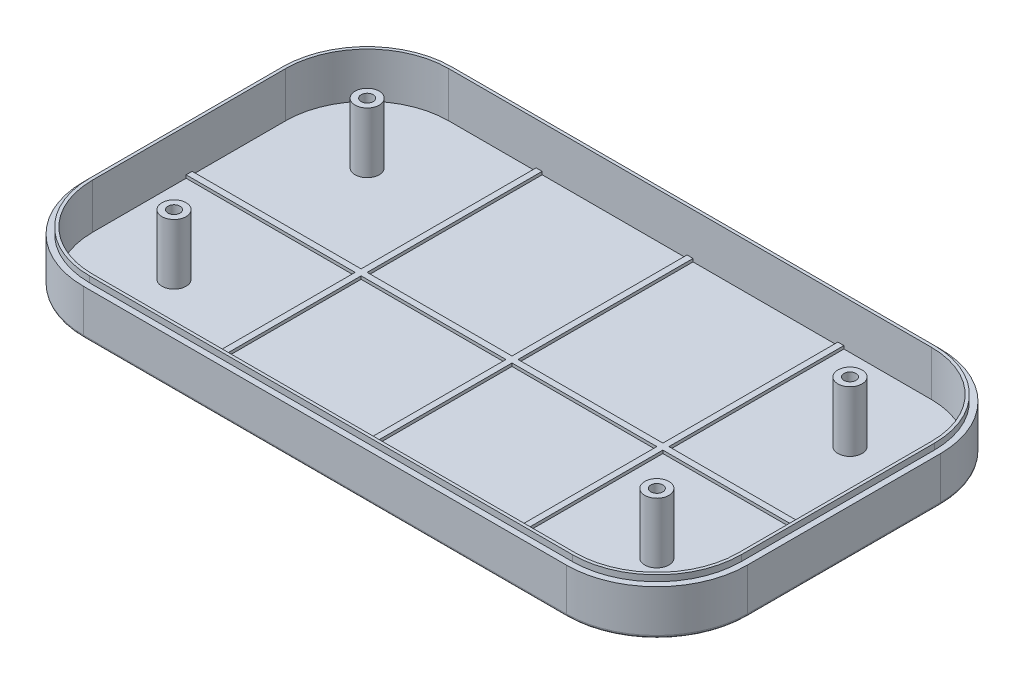
from build123d import *

# Parameters (mm, degrees)
BOSS_EXTRUDE1_DEPTH = 15
CUT_EXTRUDE1_DEPTH  = 13
BOSS_EXTRUDE2_START = 15
BOSS_EXTRUDE2_DEPTH = 15
BOSS_EXTRUDE3_DEPTH = 2
SKETCH6_R           = 4
BOSS_EXTRUDE4_DEPTH = 20
SKETCH7_R           = 2
CUT_EXTRUDE2_DEPTH  = 54
SKETCH8_R           = 3.5
CUT_EXTRUDE3_DEPTH  = 10
BOSS_EXTRUDE5_DEPTH = 1
FILLET1_R           = 1


with BuildPart() as part:
    # Sketch1 → Boss-Extrude1 (new body)
    with BuildSketch(Plane(origin=(0, 0, 0), x_dir=(1, 0, 0), z_dir=(0, 1, 0))):
        with BuildLine():
            Line((-80, 62), (80, 62))
            ThreePointArc((80, 62), (101.213203436, 53.213203436), (110, 32))
            Line((110, 32), (110, -32))
            ThreePointArc((110, -32), (101.213203436, -53.213203436), (80, -62))
            Line((80, -62), (-80, -62))
            ThreePointArc((-80, -62), (-101.213203436, -53.213203436), (-110, -32))
            Line((-110, -32), (-110, 32))
            ThreePointArc((-110, 32), (-101.213203436, 53.213203436), (-80, 62))
        make_face()
    extrude(amount=BOSS_EXTRUDE1_DEPTH)

    # Sketch2 → Cut-Extrude1 (cut)
    with BuildSketch(Plane(origin=(0, 15, 0), x_dir=(1, 0, 0), z_dir=(0, 1, 0))):
        with BuildLine():
            Line((-80, -60), (80, -60))
            ThreePointArc((80, -60), (99.798989873, -51.798989873), (108, -32))
            Line((108, -32), (108, 32))
            ThreePointArc((108, 32), (99.798989873, 51.798989873), (80, 60))
            Line((80, 60), (-80, 60))
            ThreePointArc((-80, 60), (-99.798989873, 51.798989873), (-108, 32))
            Line((-108, 32), (-108, -32))
            ThreePointArc((-108, -32), (-99.798989873, -51.798989873), (-80, -60))
        make_face()
    extrude(amount=-CUT_EXTRUDE1_DEPTH, mode=Mode.SUBTRACT)

    # Sketch3 → Boss-Extrude2 (add)
    with BuildSketch(Plane(origin=(0, 2, 0), x_dir=(1, 0, 0), z_dir=(0, 1, 0)).offset(BOSS_EXTRUDE2_START)):
        with BuildLine():
            Line((-80, -60), (80, -60))
            ThreePointArc((80, -60), (99.798989873, -51.798989873), (108, -32))
            Line((108, -32), (108, 32))
            ThreePointArc((108, 32), (99.798989873, 51.798989873), (80, 60))
            Line((80, 60), (-80, 60))
            ThreePointArc((-80, 60), (-99.798989873, 51.798989873), (-108, 32))
            Line((-108, 32), (-108, -32))
            ThreePointArc((-108, -32), (-99.798989873, -51.798989873), (-80, -60))
        make_face()
        with BuildLine():
            Line((-80, -59), (80, -59))
            ThreePointArc((80, -59), (99.091883092, -51.091883092), (107, -32))
            Line((107, -32), (107, 32))
            ThreePointArc((107, 32), (99.091883092, 51.091883092), (80, 59))
            Line((80, 59), (-80, 59))
            ThreePointArc((-80, 59), (-99.091883092, 51.091883092), (-107, 32))
            Line((-107, 32), (-107, -32))
            ThreePointArc((-107, -32), (-99.091883092, -51.091883092), (-80, -59))
        make_face(mode=Mode.SUBTRACT)
    extrude(amount=-BOSS_EXTRUDE2_DEPTH)

    # Sketch5 → Boss-Extrude3 (add)
    with BuildSketch(Plane.XZ):
        with BuildLine():
            Line((-88, 32), (-88, 20))
            Line((-88, 20), (-90, 20))
            Line((-90, 20), (-90, 32))
            ThreePointArc((-90, 32), (-87.071067812, 39.071067812), (-80, 42))
            Line((-80, 42), (-68, 42))
            Line((-68, 42), (-68, 40))
            Line((-68, 40), (-80, 40))
            ThreePointArc((-80, 40), (-85.656854249, 37.656854249), (-88, 32))
        make_face()
        with BuildLine():
            Line((-80, -40), (-68, -40))
            Line((-68, -40), (-68, -42))
            Line((-68, -42), (-80, -42))
            ThreePointArc((-80, -42), (-87.071067812, -39.071067812), (-90, -32))
            Line((-90, -32), (-90, -20))
            Line((-90, -20), (-88, -20))
            Line((-88, -20), (-88, -32))
            ThreePointArc((-88, -32), (-85.656854249, -37.656854249), (-80, -40))
        make_face()
        with BuildLine():
            Line((88, -32), (88, -20))
            Line((88, -20), (90, -20))
            Line((90, -20), (90, -32))
            ThreePointArc((90, -32), (87.071067812, -39.071067812), (80, -42))
            Line((80, -42), (68, -42))
            Line((68, -42), (68, -40))
            Line((68, -40), (80, -40))
            ThreePointArc((80, -40), (85.656854249, -37.656854249), (88, -32))
        make_face()
        with BuildLine():
            Line((80, 40), (68, 40))
            Line((68, 40), (68, 42))
            Line((68, 42), (80, 42))
            ThreePointArc((80, 42), (87.071067812, 39.071067812), (90, 32))
            Line((90, 32), (90, 20))
            Line((90, 20), (88, 20))
            Line((88, 20), (88, 32))
            ThreePointArc((88, 32), (85.656854249, 37.656854249), (80, 40))
        make_face()
    extrude(amount=BOSS_EXTRUDE3_DEPTH)

    # Sketch6 → Boss-Extrude4 (add)
    with BuildSketch(Plane(origin=(0, 2, 0), x_dir=(1, 0, 0), z_dir=(0, 1, 0))):
        with Locations((80, 32)):
            Circle(SKETCH6_R)
        with Locations((80, -32)):
            Circle(SKETCH6_R)
        with Locations((-80, -32)):
            Circle(SKETCH6_R)
        with Locations((-80, 32)):
            Circle(SKETCH6_R)
    extrude(amount=BOSS_EXTRUDE4_DEPTH)

    # Sketch7 → Cut-Extrude2 (cut)
    with BuildSketch(Plane(origin=(0, 22, 0), x_dir=(1, 0, 0), z_dir=(0, 1, 0))):
        with Locations((80, 32)):
            Circle(SKETCH7_R)
        with Locations((80, -32)):
            Circle(SKETCH7_R)
        with Locations((-80, -32)):
            Circle(SKETCH7_R)
        with Locations((-80, 32)):
            Circle(SKETCH7_R)
    extrude(amount=-CUT_EXTRUDE2_DEPTH, mode=Mode.SUBTRACT)

    # Sketch8 → Cut-Extrude3 (cut)
    with BuildSketch(Plane.XZ):
        with Locations((-80, 32)):
            Circle(SKETCH8_R)
        with Locations((-80, -32)):
            Circle(SKETCH8_R)
        with Locations((80, -32)):
            Circle(SKETCH8_R)
        with Locations((80, 32)):
            Circle(SKETCH8_R)
    extrude(amount=-CUT_EXTRUDE3_DEPTH, mode=Mode.SUBTRACT)

    # Sketch9 → Boss-Extrude5 (add)
    with BuildSketch(Plane(origin=(0, 2, 0), x_dir=(1, 0, 0), z_dir=(0, 1, 0))):
        Polygon((49, -59), (51, -59), (51, -1), (107, -1), (107, 1), (51, 1), (51, 59), (49, 59), (49, 1), (1, 1), (1, 59), (-1, 59), (-1, 1), (-49, 1), (-49, 59), (-51, 59), (-51, 1), (-107, 1), (-107, -1), (-51, -1), (-51, -59), (-49, -59), (-49, -1), (-1, -1), (-1, -59), (1, -59), (1, -1), (49, -1), align=None)
    extrude(amount=BOSS_EXTRUDE5_DEPTH)

    # Fillet1
    fillet1_edges = [part.edges().sort_by_distance(p)[0] for p in [
        (-101.213203436, 0, -53.213203436),
        (0, 0, -62),
        (101.213203436, 0, -53.213203436),
        (110, 0, 0),
        (101.213203436, 0, 53.213203436),
        (0, 0, 62),
        (-101.213203436, 0, 53.213203436),
        (-110, 0, 0),
    ]]
    fillet(fillet1_edges, radius=FILLET1_R)


solid = part.part
